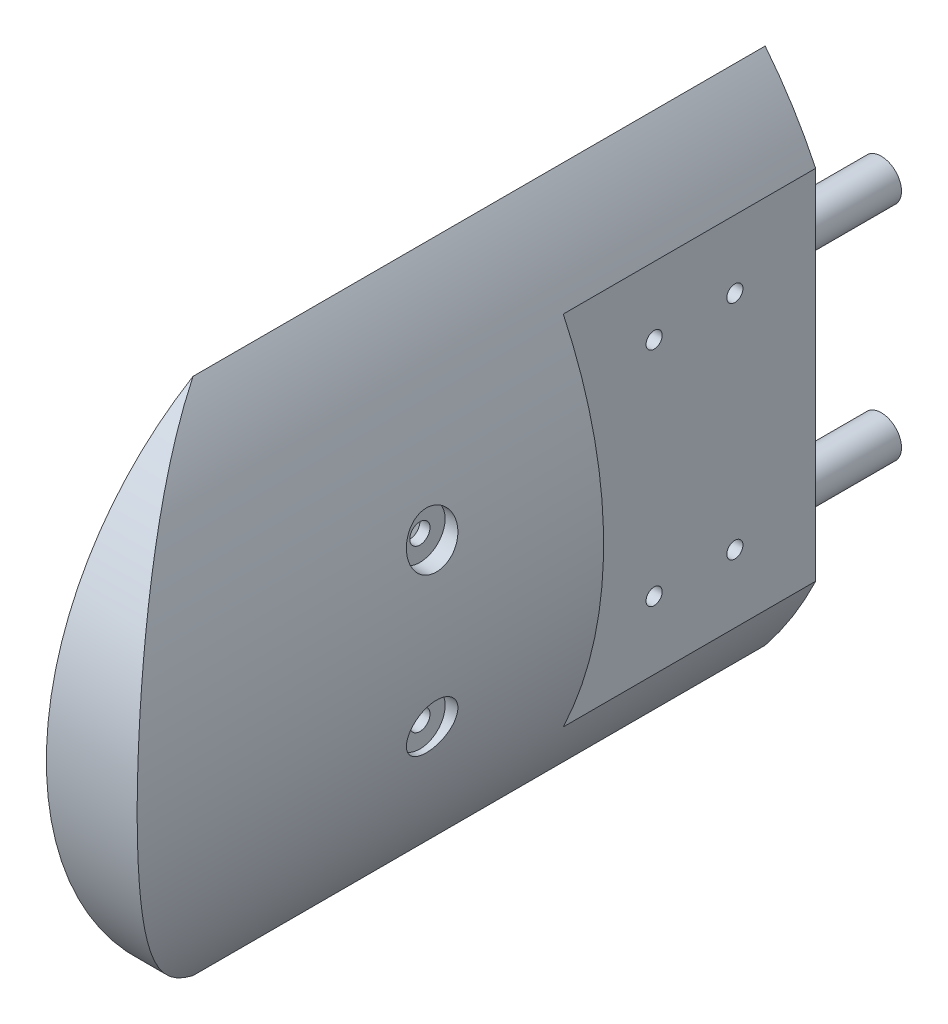
from build123d import *

# Parameters (mm, degrees)
SKETCH_1_W          = 9
SKETCH_1_H          = 60
EXTRUDE_1_DEPTH     = 41.2
SKETCH_4_R          = 30
EXTRUDE_3_DEPTH     = 9
CUT_EXTRUDE_1_DEPTH = 72
SKETCH_5_R          = 15.7
CUT_EXTRUDE_2_DEPTH = 3
SKETCH_6_W          = 4
SKETCH_6_H          = 28
CUT_EXTRUDE_3_DEPTH = 3
SKETCH_7_R          = 2
EXTRUDE_4_DEPTH     = 9
SKETCH_8_W          = 4
SKETCH_8_H          = 82.4
CUT_EXTRUDE_4_DEPTH = 25
SKETCH_9_R          = 0.8
CUT_EXTRUDE_5_DEPTH = 5
SKETCH_10_R         = 1
CUT_EXTRUDE_6_DEPTH = 1
SKETCH_11_R         = 2.5
CUT_EXTRUDE_7_DEPTH = 3


with BuildPart() as part:
    # 草图1 → 凸台-拉伸1 (new body)
    with BuildSketch(Plane.XY):
        with Locations((36.7, 0)):
            Rectangle(SKETCH_1_W, SKETCH_1_H)
    extrude(amount=EXTRUDE_1_DEPTH)

    # 草图4 → 凸台-拉伸3 (add)
    with BuildSketch(Plane.ZY.offset(-32.2)):
        with Locations((41.2, 0)):
            Circle(SKETCH_4_R)
    extrude(amount=-EXTRUDE_3_DEPTH)

    # 切除-拉伸1: read off the stored shape, not the designer's step
    # 切除-拉伸1 outline → 切除-拉伸1 (cut)
    with BuildSketch(Plane.XY):
        with BuildLine():
            Line((32.2, 30), (32.2, 25.702139989))
            ThreePointArc((32.2, 25.702139989), (38.884958532, 13.616166862), (41.2, 0))
            Line((41.2, 0), (41.2, 30))
            Line((41.2, 30), (32.2, 30))
        make_face()
        with BuildLine():
            Line((41.2, -30), (41.2, 0))
            ThreePointArc((41.2, 0), (38.884958532, -13.616166862), (32.2, -25.702139989))
            Line((32.2, -25.702139989), (32.2, -30))
            Line((32.2, -30), (41.2, -30))
        make_face()
    extrude(amount=CUT_EXTRUDE_1_DEPTH, mode=Mode.SUBTRACT)

    # 草图5 → 切除-拉伸2 (cut)
    with BuildSketch(Plane.ZY.offset(-32.2)):
        with Locations((41.2, 0)):
            Circle(SKETCH_5_R)
    extrude(amount=-CUT_EXTRUDE_2_DEPTH, mode=Mode.SUBTRACT)

    # 草图6 → 切除-拉伸3 (cut)
    with BuildSketch(Plane.ZY.offset(-35.2)):
        with Locations((41.2, 0)):
            Rectangle(SKETCH_6_W, SKETCH_6_H)
    extrude(amount=-CUT_EXTRUDE_3_DEPTH, mode=Mode.SUBTRACT)

    # 草图7 → 凸台-拉伸4 (add)
    with BuildSketch(Plane(origin=(0, 0, 0), x_dir=(-1, 0, 0), z_dir=(0, 0, -1))):
        with Locations(Location((-34.7, 11, 0), (0, 0, 180))):
            Circle(SKETCH_7_R)
        with Locations(Location((-34.7, -11, 0), (0, 0, 180))):
            Circle(SKETCH_7_R)
    extrude(amount=EXTRUDE_4_DEPTH)

    # 草图8 → 切除-拉伸4 (cut)
    with BuildSketch(Plane.XY):
        with Locations((39.2, 0)):
            Rectangle(SKETCH_8_W, SKETCH_8_H)
    extrude(amount=CUT_EXTRUDE_4_DEPTH, mode=Mode.SUBTRACT)

    # 草图9 → 切除-拉伸5 (cut)
    with BuildSketch(Plane(origin=(37.2, 0, 0), x_dir=(0, 0, -1), z_dir=(1, 0, 0))):
        with Locations((-16, -11)):
            Circle(SKETCH_9_R)
        with Locations((-8, -11)):
            Circle(SKETCH_9_R)
        with Locations((-16, 11)):
            Circle(SKETCH_9_R)
        with Locations((-8, 11)):
            Circle(SKETCH_9_R)
    extrude(amount=-CUT_EXTRUDE_5_DEPTH, mode=Mode.SUBTRACT)

    # 草图10 → 切除-拉伸6 (cut)
    with BuildSketch(Plane.ZY.offset(-38.2)):
        with Locations((41.2, 8)):
            Circle(SKETCH_10_R)
        with Locations((41.2, -8)):
            Circle(SKETCH_10_R)
    extrude(amount=-CUT_EXTRUDE_6_DEPTH, mode=Mode.SUBTRACT)

    # 草图11 → 切除-拉伸7 (cut)
    with BuildSketch(Plane.ZY.offset(-39.2)):
        with Locations((41.2, 8)):
            Circle(SKETCH_11_R)
        with Locations((41.2, -8)):
            Circle(SKETCH_11_R)
    extrude(amount=-CUT_EXTRUDE_7_DEPTH, mode=Mode.SUBTRACT)


solid = part.part
